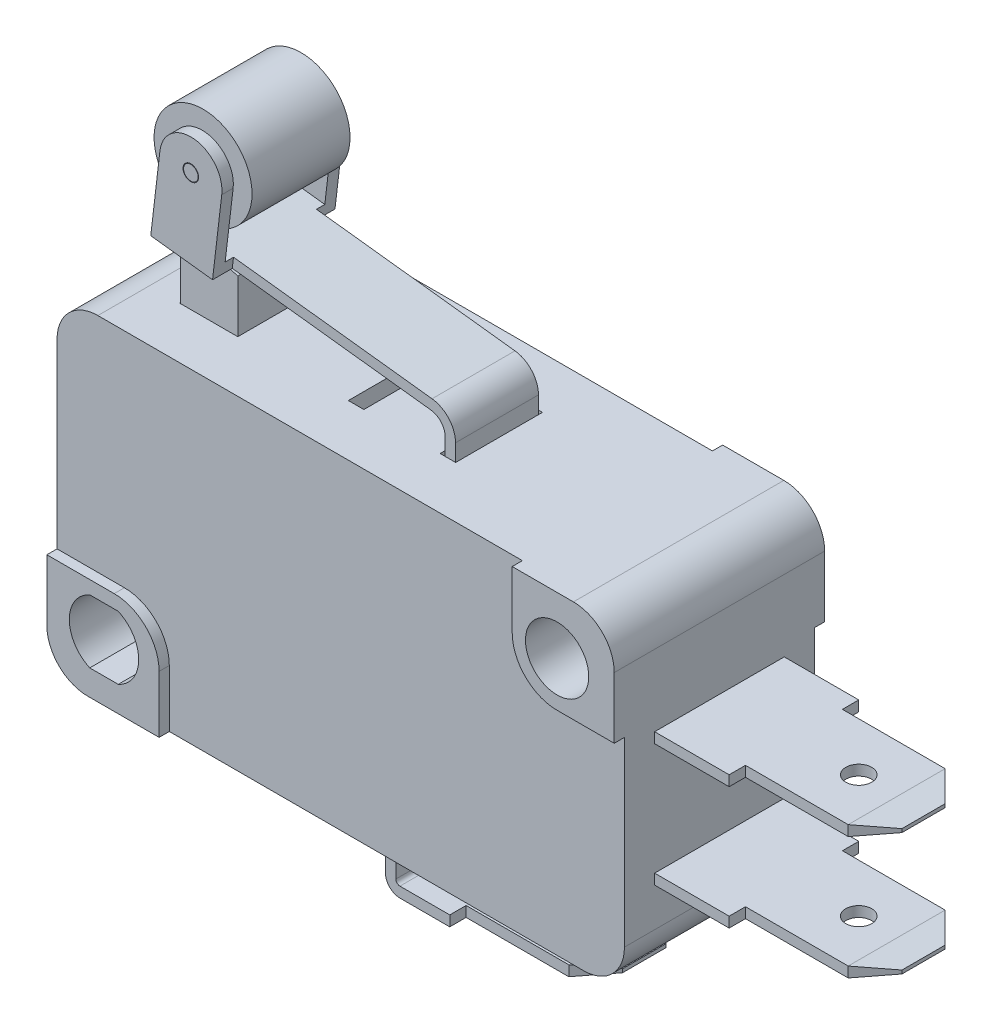
from build123d import *

# Parameters (mm, degrees)
SKETCH1_W               = 27.8
SKETCH1_H               = 15.9
SKETCH1_R               = 1.55
EXTRUDE1_DEPTH          = 5.155
FILLET1_R               = 2
EXTRUDE2_DEPTH          = 2.1
SKETCH3_W               = 2.8508
SKETCH3_H               = 4.2508
SKETCH3_W_2             = 0.762
CUT_EXTRUDE1_DEPTH      = 2
CUT_EXTRUDE2_DEPTH      = 0.5
EXTRUDE3_DEPTH          = 3.175
SKETCH6_R               = 0.635
CUT_EXTRUDE3_DEPTH      = 26.780932664
EXTRUDE4_START          = -5.5
SKETCH8_R               = 0.635
EXTRUDE4_DEPTH          = 0.508
LPATTERN1_COUNT         = 2
LPATTERN1_PITCH         = 6
CUT_EXTRUDE4_DEPTH      = 27.748953718
CUT_EXTRUDE4_DEPTH_BACK = 27.748953718
ROLLER_START            = -2.032
ROLLER_DEPTH            = 4.064
ROLLER_START_2          = -3
ROLLER_2_OUTLINE_R      = 0.381
ROLLER_2_DEPTH          = 0.5588
ROLLER_START_3          = 2.4412
ROLLER_3_OUTLINE_R      = 0.381
ROLLER_3_DEPTH          = 0.5588
ROLLER_START_4          = -2.4412
ROLLER_4_DEPTH          = 4.8824
ROLLER_START_5          = -2.4
ROLLER_5_OUTLINE_R      = 2.4
ROLLER_5_DEPTH          = 4.8
ROLLER_6_OUTLINE_R      = 0.3556
ROLLER_6_DEPTH          = 6


# Read off the part's stored shape, not the designer's step: Roller
with BuildPart() as part:
    # Sketch1 → Extrude1 (new, symmetric)
    with BuildSketch(Plane.XY):
        Rectangle(SKETCH1_W, SKETCH1_H)
        with Locations((11.1, 5.15)):
            Circle(SKETCH1_R, mode=Mode.SUBTRACT)
        with BuildLine():
            Line((-11.798212002, -3.6), (-10.401787998, -3.6))
            ThreePointArc((-10.401787998, -3.6), (-9.4, -5.15), (-10.401787998, -6.7))
            Line((-10.401787998, -6.7), (-11.798212002, -6.7))
            ThreePointArc((-11.798212002, -6.7), (-12.8, -5.15), (-11.798212002, -3.6))
        make_face(mode=Mode.SUBTRACT)
    extrude(amount=EXTRUDE1_DEPTH, both=True)

    # Fillet1
    fillet1_edges = [part.edges().sort_by_distance(p)[0] for p in [
        (-13.9, 7.95, 0),
        (13.9, 7.95, 0),
        (13.9, -7.95, 0),
        (-13.9, -7.95, 0),
    ]]
    fillet(fillet1_edges, radius=FILLET1_R)

    # Sketch3 → Cut-Extrude1 (cut)
    with BuildSketch(Plane(origin=(0, 7.95, 0), x_dir=(-1, 0, 0), z_dir=(0, 1, 0))):
        with Locations((9, 0)):
            Rectangle(SKETCH3_W, SKETCH3_H)
        with Locations((1.7768, 0)):
            Rectangle(SKETCH3_W_2, SKETCH3_H)
        with Locations((-2.719, 0)):
            Rectangle(SKETCH3_W_2, SKETCH3_H)
    extrude(amount=-CUT_EXTRUDE1_DEPTH, mode=Mode.SUBTRACT)

    # Sketch4 → Cut-Extrude2 (cut)
    with BuildSketch(Plane.XY.offset(5.155)):
        with BuildLine():
            Line((-8.4, -7.95), (13.9, -7.95))
            Line((13.9, -7.95), (13.9, 2.95))
            Line((13.9, 2.95), (11.1, 2.95))
            ThreePointArc((11.1, 2.95), (9.544365081, 3.594365081), (8.9, 5.15))
            Line((8.9, 5.15), (8.9, 7.95))
            Line((8.9, 7.95), (-13.9, 7.95))
            Line((-13.9, 7.95), (-13.9, -2.95))
            Line((-13.9, -2.95), (-10.6, -2.95))
            ThreePointArc((-10.6, -2.95), (-9.044365081, -3.594365081), (-8.4, -5.15))
            Line((-8.4, -5.15), (-8.4, -7.95))
        make_face()
    cut_extrude2 = extrude(amount=-CUT_EXTRUDE2_DEPTH, mode=Mode.SUBTRACT)

    # Mirror1: Cut-Extrude2 across plane
    add(cut_extrude2.mirror(Plane.XY), mode=Mode.SUBTRACT)

    # Sketch5 → Extrude3 (add, symmetric)
    with BuildSketch(Plane.XY):
        with BuildLine():
            Line((0.711, -7.95), (0.711, -10.142))
            ThreePointArc((0.711, -10.142), (0.918368399, -10.642631601), (1.419, -10.85))
            Line((1.419, -10.85), (10.211, -10.85))
            Line((10.211, -10.85), (10.211, -10.342))
            Line((10.211, -10.342), (1.419, -10.342))
            ThreePointArc((1.419, -10.342), (1.277578644, -10.283421356), (1.219, -10.142))
            Line((1.219, -10.142), (1.219, -7.95))
            Line((1.219, -7.95), (0.711, -7.95))
        make_face()
    extrude(amount=EXTRUDE3_DEPTH, both=True)

    # Sketch6 → Cut-Extrude3 (cut, through all)
    with BuildSketch(Plane(origin=(0, -10.342, 0), x_dir=(-1, 0, 0), z_dir=(0, 1, 0))):
        with Locations((-7.036, 0)):
            Circle(SKETCH6_R)
        Polygon((-10.211, 1.058333333), (-8.894433333, 2.3749), (-3.861, 2.3749), (-3.861, 3.175), (-10.211, 3.175), align=None)
        Polygon((-10.211, -3.175), (-10.211, -1.058333333), (-8.894433333, -2.3749), (-3.861, -2.3749), (-3.861, -3.175), align=None)
    extrude(amount=-CUT_EXTRUDE3_DEPTH, mode=Mode.SUBTRACT)

    # Sketch8 → Extrude4 (add)
    with BuildSketch(Plane(origin=(0, 7.95, 0), x_dir=(-1, 0, 0), z_dir=(0, 1, 0)).offset(EXTRUDE4_START)):
        Polygon((-13.9, -3.175), (-17.55, -3.175), (-17.55, -2.3749), (-22.583433333, -2.3749), (-23.9, -1.058333333), (-23.9, 1.058333333), (-22.583433333, 2.3749), (-17.55, 2.3749), (-17.55, 3.175), (-13.9, 3.175), align=None)
        with Locations((-20.725, 0)):
            Circle(SKETCH8_R, mode=Mode.SUBTRACT)
    extrude4 = extrude(amount=-EXTRUDE4_DEPTH)

    # LPattern1: Extrude4 ×2
    with Locations(*[(0, -i * LPATTERN1_PITCH, 0) for i in range(1, LPATTERN1_COUNT)]):
        add(extrude4)

    # Sketch7 → Cut-Extrude4 (cut, two sides: drawn at the far end of the back side and taken through both)
    with BuildSketch(Plane.XY.offset(-CUT_EXTRUDE4_DEPTH_BACK)):
        Polygon((8.894433333, -10.342), (10.211, -10.342), (10.211, -10.511333333), align=None)
        Polygon((8.894433333, -10.85), (10.211, -10.85), (10.211, -10.680666667), align=None)
        Polygon((23.9, -3.719333333), (22.583433333, -3.55), (23.9, -3.55), align=None)
        Polygon((23.9, -3.888666667), (23.9, -4.058), (22.583433333, -4.058), align=None)
        Polygon((22.583433333, 2.45), (23.9, 2.280666667), (23.9, 2.45), align=None)
        Polygon((23.9, 2.111333333), (23.9, 1.942), (22.583433333, 1.942), align=None)
    extrude(amount=CUT_EXTRUDE4_DEPTH + CUT_EXTRUDE4_DEPTH_BACK, mode=Mode.SUBTRACT)


with BuildPart() as body_2:
    # Sketch2 → Extrude2 (new, symmetric)
    with BuildSketch(Plane.XY):
        with BuildLine():
            Line((-10.4, 7.496998799), (-10.4, 10.496998799))
            ThreePointArc((-10.4, 10.496998799), (-9, 10.75), (-7.6, 10.496998799))
            Line((-7.6, 10.496998799), (-7.6, 7.496998799))
            Line((-7.6, 7.496998799), (-10.4, 7.496998799))
        make_face()
    extrude(amount=EXTRUDE2_DEPTH, both=True)


with BuildPart() as body_3:
    # Roller outline → Roller (new body)
    with BuildSketch(Plane.XY.offset(ROLLER_START)):
        with BuildLine():
            Line((-10.904788918, 11.48255895), (-10.964120967, 10.978035702))
            Line((-10.964120967, 10.978035702), (1.790956327, 9.478035702))
            ThreePointArc((1.790956327, 9.478035702), (2.29138772, 9.217190124), (2.492, 8.689718127))
            Line((2.492, 8.689718127), (2.492, 7.478248799))
            Line((2.492, 7.478248799), (3, 7.478248799))
            Line((3, 7.478248799), (3, 8.689718127))
            ThreePointArc((3, 8.689718127), (2.67099586, 9.554772202), (1.850288376, 9.98255895))
            Line((1.850288376, 9.98255895), (-10.904788918, 11.48255895))
        make_face()
    extrude(amount=ROLLER_DEPTH)

    # Roller 2 outline → Roller 2 (add)
    with BuildSketch(Plane.XY.offset(ROLLER_START_2)):
        with BuildLine():
            Line((-10.513569745, 14.809246147), (-10.964120967, 10.978035702))
            Line((-10.964120967, 10.978035702), (-7.936981478, 10.622043407))
            Line((-7.936981478, 10.622043407), (-7.486430255, 14.453253853))
            ThreePointArc((-7.486430255, 14.453253853), (-8.822003853, 16.144819745), (-10.513569745, 14.809246147))
        make_face()
        with Locations((-9, 14.63125)):
            Circle(ROLLER_2_OUTLINE_R, mode=Mode.SUBTRACT)
    extrude(amount=ROLLER_2_DEPTH)

    # Roller 3 outline → Roller 3 (add)
    with BuildSketch(Plane.XY.offset(ROLLER_START_3)):
        with BuildLine():
            Line((-10.513569745, 14.809246147), (-10.964120967, 10.978035702))
            Line((-10.964120967, 10.978035702), (-7.936981478, 10.622043407))
            Line((-7.936981478, 10.622043407), (-7.486430255, 14.453253853))
            ThreePointArc((-7.486430255, 14.453253853), (-8.822003853, 16.144819745), (-10.513569745, 14.809246147))
        make_face()
        with Locations((-9, 14.63125)):
            Circle(ROLLER_3_OUTLINE_R, mode=Mode.SUBTRACT)
    extrude(amount=ROLLER_3_DEPTH)

    # Roller 4 outline → Roller 4 (add)
    with BuildSketch(Plane.XY.offset(ROLLER_START_4)):
        Polygon((-7.877649429, 11.126566655), (-10.904788918, 11.48255895), (-10.964120967, 10.978035702), (-7.936981478, 10.622043407), align=None)
    extrude(amount=ROLLER_4_DEPTH)


with BuildPart() as body_4:
    # Roller 5 outline → Roller 5 (new body)
    with BuildSketch(Plane.XY.offset(ROLLER_START_5)):
        with Locations((-9, 14.63125)):
            Circle(ROLLER_5_OUTLINE_R)
    extrude(amount=ROLLER_5_DEPTH)

    # Roller 6 outline → Roller 6 (add)
    with BuildSketch(Plane.XY.offset(ROLLER_START_2)):
        with Locations((-9, 14.63125)):
            Circle(ROLLER_6_OUTLINE_R)
    extrude(amount=ROLLER_6_DEPTH)


solid = Compound([part.part, body_2.part, body_3.part, body_4.part])
